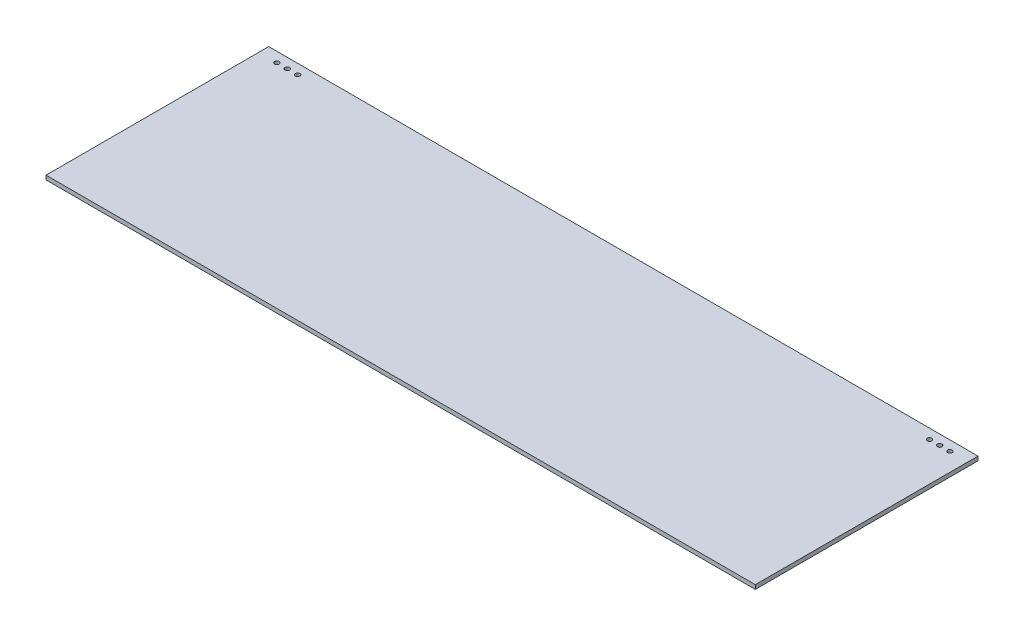
from build123d import *

# Parameters (mm, degrees)
SKETCH1_W           = 546.1
SKETCH1_H           = 3.175
BOSS_EXTRUDE1_DEPTH = 171.45
SKETCH2_R           = 1.778
CUT_EXTRUDE2_DEPTH  = 323.430590399


with BuildPart() as part:
    # Sketch1 → Boss-Extrude1 (new body)
    with BuildSketch(Plane.XY):
        Rectangle(SKETCH1_W, SKETCH1_H)
    extrude(amount=BOSS_EXTRUDE1_DEPTH)

    # Sketch2 → Cut-Extrude2 (cut, through all)
    with BuildSketch(Plane(origin=(0, 1.5875, 0), x_dir=(1, 0, 0), z_dir=(0, 1, 0))):
        with Locations((-259.08, -7.62)):
            Circle(SKETCH2_R)
        with Locations((259.08, -7.62)):
            Circle(SKETCH2_R)
        with Locations((243.332, -7.62)):
            Circle(SKETCH2_R)
        with Locations((251.206, -7.62)):
            Circle(SKETCH2_R)
        with Locations((-251.079, -7.62)):
            Circle(SKETCH2_R)
        with Locations((-243.078, -7.62)):
            Circle(SKETCH2_R)
    extrude(amount=-CUT_EXTRUDE2_DEPTH, mode=Mode.SUBTRACT)


solid = part.part
